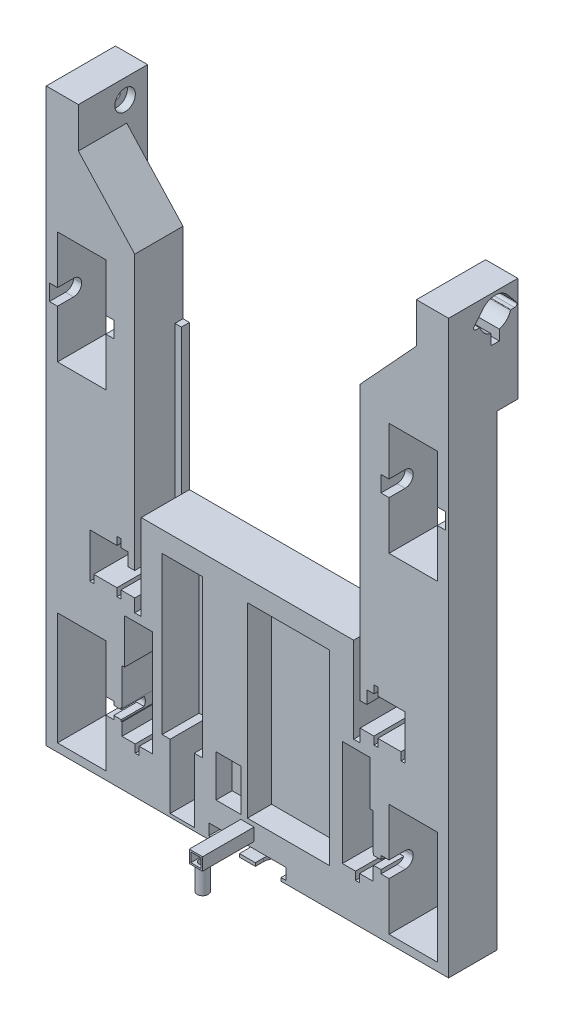
from build123d import *

# Parameters (mm, degrees)
SKETCH1_W                    = 250
SKETCH1_H                    = 330
BOSS_EXTRUDE2_DEPTH          = 30
SKETCH2_W                    = 8.25
SKETCH2_H                    = 7.8
BOSS_EXTRUDE4_DEPTH          = 32
SKETCH6_W                    = 6.25
SKETCH6_H                    = 5.8
CUT_EXTRUDE1_DEPTH           = 7
SKETCH7_R                    = 2.4
CUT_EXTRUDE2_DEPTH           = 1
ULTRASONIC_SENSOR_EYES_DEPTH = 2
SKETCH2_5_W                  = 30
SKETCH2_5_H                  = 70
WHEEL_HOLES_DEPTH            = 416.239689818
SKETCH2_6_W                  = 48
SKETCH2_6_H                  = 7
ULTRASONIC_SENSOR_DEPTH      = 15
SKETCH2_7_W                  = 15
SKETCH2_7_H                  = 40
SKETCH2_7_W_2                = 25
SKETCH2_7_H_2                = 97.5
CUT_EXTRUDE5_DEPTH           = 23
SKETCH2_9_W                  = 51
SKETCH2_9_H                  = 116
CUT_EXTRUDE6_DEPTH           = 15
SKETCH2_10_W                 = 15.5
SKETCH2_10_H                 = 26
CUT_EXTRUDE7_DEPTH           = 10
EXTRUDE_THIN3_START          = 15
SKETCH7_5_R                  = 3.4
SKETCH7_5_R_2                = 2.4
EXTRUDE_THIN3_DEPTH          = 15
SKETCH2_11_W                 = 17.3
SKETCH2_11_H                 = 27.7
SKETCH2_11_W_2               = 2.5
SKETCH2_11_H_2               = 5
CUT_EXTRUDE8_DEPTH           = 21.25
CUT_EXTRUDE9_DEPTH           = 416.239689818
CUT_EXTRUDE9_DEPTH_BACK      = 15
SKETCH2_12_W                 = 5
SKETCH2_12_H                 = 10
CUT_EXTRUDE11_DEPTH          = 25
BOSS_EXTRUDE5_DEPTH          = 20
BOSS_EXTRUDE6_START          = -230
BOSS_EXTRUDE6_DEPTH          = 20
SKETCH8_R                    = 2
CUT_EXTRUDE12_DEPTH          = 15
CUT_EXTRUDE13_DEPTH          = 18
SKETCH8_5_R                  = 2
CUT_EXTRUDE14_DEPTH          = 439.598905607
CUT_EXTRUDE17_DEPTH          = 437.318690867
SKETCH2_17_W                 = 50
SKETCH2_17_H                 = 9
SKETCH2_17_W_2               = 48
SKETCH2_17_H_2               = 7
EXTRUDE_THIN4_DEPTH          = 15
CUT_EXTRUDE18_DEPTH          = 1
FILLET2_R                    = 5
SKETCH2_18_W                 = 4
SKETCH2_18_H                 = 12.24
SKETCH2_18_H_2               = 8
CUT_EXTRUDE19_DEPTH          = 437.318690867
SKETCH15_R                   = 6.39
SKETCH15_R_2                 = 0.9
CUT_EXTRUDE20_DEPTH          = 5
CUT_EXTRUDE21_START          = 215
SKETCH15_2_R                 = 6.39
SKETCH15_2_R_2               = 0.9
CUT_EXTRUDE21_DEPTH          = 5
SKETCH2_19_W                 = 132
SKETCH2_19_H                 = 89.974629058
CUT_EXTRUDE22_DEPTH          = 437.318690867
SKETCH18_W                   = 15
SKETCH18_H                   = 9
CUT_EXTRUDE23_DEPTH          = 412.66734143


with BuildPart() as part:
    # Sketch1 → Boss-Extrude2 (new body)
    with BuildSketch(Plane.XY):
        with Locations((125, 165)):
            Rectangle(SKETCH1_W, SKETCH1_H)
    extrude(amount=BOSS_EXTRUDE2_DEPTH)

    # Sketch2 → Boss-Extrude4 (add)
    with BuildSketch(Plane.XY.offset(30)):
        with Locations((125, 16.9)):
            Rectangle(SKETCH2_W, SKETCH2_H)
    extrude(amount=BOSS_EXTRUDE4_DEPTH)

    # Sketch6 → Cut-Extrude1 (cut)
    with BuildSketch(Plane.XY.offset(62)):
        with Locations((125, 16.9)):
            Rectangle(SKETCH6_W, SKETCH6_H)
    extrude(amount=-CUT_EXTRUDE1_DEPTH, mode=Mode.SUBTRACT)

    # Sketch7 → Cut-Extrude2 (cut)
    with BuildSketch(Plane.XZ.offset(-13)):
        with Locations((125, 57.76)):
            Circle(SKETCH7_R)
    extrude(amount=-CUT_EXTRUDE2_DEPTH, mode=Mode.SUBTRACT)

    # US → Ultrasonic Sensor Eyes (cut)
    with BuildSketch(Plane.XZ):
        with BuildLine():
            Line((104.075, 30), (104.075, 25))
            ThreePointArc((104.075, 25), (112.075, 17), (120.075, 25))
            Line((120.075, 25), (120.075, 30))
            Line((120.075, 30), (104.075, 30))
        make_face()
        with BuildLine():
            Line((145.925, 30), (129.925, 30))
            Line((129.925, 30), (129.925, 25))
            ThreePointArc((129.925, 25), (137.925, 17), (145.925, 25))
            Line((145.925, 25), (145.925, 30))
        make_face()
    extrude(amount=-ULTRASONIC_SENSOR_EYES_DEPTH, mode=Mode.SUBTRACT)

    # Sketch2<5> → Wheel Holes (cut, through all)
    with BuildSketch(Plane.XY.offset(30)):
        with Locations((22, 40)):
            Rectangle(SKETCH2_5_W, SKETCH2_5_H)
        with Locations((228, 40)):
            Rectangle(SKETCH2_5_W, SKETCH2_5_H)
        with Locations((22, 245)):
            Rectangle(SKETCH2_5_W, SKETCH2_5_H)
        with Locations((228, 245)):
            Rectangle(SKETCH2_5_W, SKETCH2_5_H)
    extrude(amount=-WHEEL_HOLES_DEPTH, mode=Mode.SUBTRACT)

    # Sketch2<6> → Ultrasonic Sensor (cut)
    with BuildSketch(Plane.XY.offset(30)):
        with Locations((125, 5.5)):
            Rectangle(SKETCH2_6_W, SKETCH2_6_H)
    extrude(amount=-ULTRASONIC_SENSOR_DEPTH, mode=Mode.SUBTRACT)

    # Sketch2<7> → Cut-Extrude5 (cut)
    with BuildSketch(Plane.XY.offset(30)):
        with Locations((84.5, 22)):
            Rectangle(SKETCH2_7_W, SKETCH2_7_H)
        with Locations((84.5, 90.75)):
            Rectangle(SKETCH2_7_W_2, SKETCH2_7_H_2)
    extrude(amount=-CUT_EXTRUDE5_DEPTH, mode=Mode.SUBTRACT)

    # Sketch2<9> → Cut-Extrude6 (cut)
    with BuildSketch(Plane.XY.offset(30)):
        with Locations((150.5, 81.5)):
            Rectangle(SKETCH2_9_W, SKETCH2_9_H)
    extrude(amount=-CUT_EXTRUDE6_DEPTH, mode=Mode.SUBTRACT)

    # Sketch2<10> → Cut-Extrude7 (cut)
    with BuildSketch(Plane.XY.offset(30)):
        with Locations((113.25, 36.5)):
            Rectangle(SKETCH2_10_W, SKETCH2_10_H)
    extrude(amount=-CUT_EXTRUDE7_DEPTH, mode=Mode.SUBTRACT)

    # Sketch7<5> → Extrude-Thin3 (add)
    with BuildSketch(Plane.XZ.offset(-13).offset(EXTRUDE_THIN3_START)):
        with Locations((125, 57.76)):
            Circle(SKETCH7_5_R)
        with Locations((125, 57.76)):
            Circle(SKETCH7_5_R_2, mode=Mode.SUBTRACT)
    extrude(amount=-EXTRUDE_THIN3_DEPTH)

    # Sketch2<11> → Cut-Extrude8 (cut)
    with BuildSketch(Plane.XY.offset(30)):
        with Locations((57.35, 80.45)):
            Rectangle(SKETCH2_11_W, SKETCH2_11_H)
        Polygon((46.6, 42.675), (46.6, 37.325), (46.6, 36.25), (47.1, 36.25), (47.1, 28.6), (55.3, 28.6), (57.8, 28.6), (66, 28.6), (66, 66.6), (48.7, 66.6), (47.1, 66.6), (47.1, 43.75), (46.6, 43.75), align=None)
        with Locations((192.65, 80.45)):
            Rectangle(SKETCH2_11_W, SKETCH2_11_H)
        Polygon((203.4, 42.675), (203.4, 43.75), (202.9, 43.75), (202.9, 66.6), (201.3, 66.6), (184, 66.6), (184, 28.6), (192.2, 28.6), (194.7, 28.6), (202.9, 28.6), (202.9, 36.25), (203.4, 36.25), (203.4, 37.325), align=None)
        with Locations((193.45, 26.1)):
            Rectangle(SKETCH2_11_W_2, SKETCH2_11_H_2)
        with Locations((56.55, 26.1)):
            Rectangle(SKETCH2_11_W_2, SKETCH2_11_H_2)
    extrude(amount=-CUT_EXTRUDE8_DEPTH, mode=Mode.SUBTRACT)

    # Sketch2<12> → Cut-Extrude9 (cut, two sides: drawn at the far end of the back side and taken through both)
    with BuildSketch(Plane.XY.offset(30).offset(-CUT_EXTRUDE9_DEPTH_BACK)):
        Polygon((37, 45), (42, 45), (42, 42.675), (46.6, 42.675), (46.6, 37.325), (42, 37.325), (42, 35), (37, 35), align=None)
        Polygon((208, 42.675), (203.4, 42.675), (203.4, 37.325), (208, 37.325), (208, 35), (213, 35), (213, 45), (208, 45), align=None)
        with Locations((210.5, 245)):
            Rectangle(SKETCH2_12_W, SKETCH2_12_H)
        with Locations((245.5, 245)):
            Rectangle(SKETCH2_12_W, SKETCH2_12_H)
        with Locations((4.5, 245)):
            Rectangle(SKETCH2_12_W, SKETCH2_12_H)
        with Locations((39.5, 245)):
            Rectangle(SKETCH2_12_W, SKETCH2_12_H)
    extrude(amount=CUT_EXTRUDE9_DEPTH + CUT_EXTRUDE9_DEPTH_BACK, mode=Mode.SUBTRACT)

    # Sketch2<14> → Cut-Extrude11 (cut)
    with BuildSketch(Plane.XY.offset(30)):
        Polygon((50.8, 129.71), (46.39, 129.71), (46.39, 134.62), (43.93, 134.62), (43.93, 129.71), (27.05, 129.71), (27.05, 107), (27.05, 102), (29.54, 102), (29.54, 107), (43.94, 107), (43.94, 102.13), (46.4, 102.13), (46.4, 107), (55, 107), (55, 119.24), (55, 121.74), (50.8, 121.74), align=None)
        Polygon((55, 242.25), (55, 121.74), (55, 119.24), (59, 119.24), (59, 152.275370942), (59, 242.25), align=None)
        Polygon((195, 242.25), (191, 242.25), (191, 152.275370942), (191, 119.24), (195, 119.24), (195, 121.74), align=None)
        Polygon((203.61, 129.71), (203.61, 134.62), (206.07, 134.62), (206.07, 129.71), (222.95, 129.71), (222.95, 107), (222.95, 102), (220.46, 102), (220.46, 107), (206.06, 107), (206.06, 102.13), (203.6, 102.13), (203.6, 107), (195, 107), (195, 121.74), (199.2, 121.74), (199.2, 129.71), align=None)
    extrude(amount=-CUT_EXTRUDE11_DEPTH, mode=Mode.SUBTRACT)

    # Sketch8<6> → Boss-Extrude5 (add)
    with BuildSketch(Plane(origin=(250, 0, 0), x_dir=(0, 0, -1), z_dir=(1, 0, 0))):
        Polygon((0, 290), (13, 290), (13, 355), (-30, 355), (-30, 330), (0, 330), align=None)
    extrude(amount=-BOSS_EXTRUDE5_DEPTH)

    # Sketch8<7> → Boss-Extrude6 (add)
    with BuildSketch(Plane(origin=(250, 0, 0), x_dir=(0, 0, -1), z_dir=(1, 0, 0)).offset(BOSS_EXTRUDE6_START)):
        Polygon((0, 290), (13, 290), (13, 355), (-30, 355), (-30, 330), (0, 330), align=None)
    extrude(amount=-BOSS_EXTRUDE6_DEPTH)

    # Sketch8 → Cut-Extrude12 (cut)
    with BuildSketch(Plane(origin=(250, 0, 0), x_dir=(0, 0, -1), z_dir=(1, 0, 0))):
        with BuildLine():
            ThreePointArc((6.535781289, 349.419821665), (-1.000523494, 352.9), (-8.536828278, 349.419821665))
            Line((-8.536828278, 349.419821665), (-14.167402552, 342.556010673))
            ThreePointArc((-14.167402552, 342.556010673), (-14.351046989, 341.065129745), (-13.081909007, 340.261550251))
            Line((-13.081909007, 340.261550251), (-10.78148506, 340.261550251))
            ThreePointArc((-10.78148506, 340.261550251), (-10.568809618, 340.192013943), (-10.438293426, 340.010267786))
            ThreePointArc((-10.438293426, 340.010267786), (-7.818343872, 335.821746361), (-3.500523494, 333.420855988))
            Line((-3.500523494, 333.420855988), (-3.500523494, 327.035828802))
            Line((-3.500523494, 327.035828802), (1.499476506, 327.035828802))
            Line((1.499476506, 327.035828802), (1.499476506, 333.420855988))
            ThreePointArc((1.499476506, 333.420855988), (5.817296883, 335.821746361), (8.437246438, 340.010267786))
            ThreePointArc((8.437246438, 340.010267786), (8.567762629, 340.192013943), (8.780438072, 340.261550251))
            Line((8.780438072, 340.261550251), (11.080862018, 340.261550251))
            ThreePointArc((11.080862018, 340.261550251), (12.35, 341.065129745), (12.166355564, 342.556010673))
            Line((12.166355564, 342.556010673), (6.535781289, 349.419821665))
        make_face()
        with BuildLine():
            ThreePointArc((-13.081909007, 340.835550251), (-13.911909007, 341.665550251), (-13.081909007, 342.495550251))
            Line((-13.081909007, 342.495550251), (-12.761909007, 342.495550251))
            ThreePointArc((-12.761909007, 342.495550251), (-11.931909007, 341.665550251), (-12.761909007, 340.835550251))
            Line((-12.761909007, 340.835550251), (-13.081909007, 340.835550251))
        make_face(mode=Mode.SUBTRACT)
        with Locations(Location((-1.000523494, 343, 0), (0, 0, 90))):
            Circle(SKETCH8_R, mode=Mode.SUBTRACT)
        with BuildLine():
            Line((10.760862018, 342.495550251), (11.080862018, 342.495550251))
            ThreePointArc((11.080862018, 342.495550251), (11.910862018, 341.665550251), (11.080862018, 340.835550251))
            Line((11.080862018, 340.835550251), (10.760862018, 340.835550251))
            ThreePointArc((10.760862018, 340.835550251), (9.930862018, 341.665550251), (10.760862018, 342.495550251))
        make_face(mode=Mode.SUBTRACT)
    extrude(amount=-CUT_EXTRUDE12_DEPTH, mode=Mode.SUBTRACT)

    # Sketch8<4> → Cut-Extrude13 (cut)
    with BuildSketch(Plane(origin=(250, 0, 0), x_dir=(0, 0, -1), z_dir=(1, 0, 0))):
        with BuildLine():
            Line((-13.081909007, 340.835550251), (-12.761909007, 340.835550251))
            ThreePointArc((-12.761909007, 340.835550251), (-11.931909007, 341.665550251), (-12.761909007, 342.495550251))
            Line((-12.761909007, 342.495550251), (-13.081909007, 342.495550251))
            ThreePointArc((-13.081909007, 342.495550251), (-13.911909007, 341.665550251), (-13.081909007, 340.835550251))
        make_face()
        with BuildLine():
            ThreePointArc((10.760862018, 340.835550251), (9.930862018, 341.665550251), (10.760862018, 342.495550251))
            Line((10.760862018, 342.495550251), (11.080862018, 342.495550251))
            ThreePointArc((11.080862018, 342.495550251), (11.910862018, 341.665550251), (11.080862018, 340.835550251))
            Line((11.080862018, 340.835550251), (10.760862018, 340.835550251))
        make_face()
    extrude(amount=-CUT_EXTRUDE13_DEPTH, mode=Mode.SUBTRACT)

    # Sketch8<5> → Cut-Extrude14 (cut, through all)
    with BuildSketch(Plane(origin=(250, 0, 0), x_dir=(0, 0, -1), z_dir=(1, 0, 0))):
        with Locations(Location((-1.000523494, 343, 0), (0, 0, 90))):
            Circle(SKETCH8_5_R)
    extrude(amount=-CUT_EXTRUDE14_DEPTH, mode=Mode.SUBTRACT)

    # Sketch2<16> → Cut-Extrude17 (cut, through all)
    with BuildSketch(Plane.XY.offset(30)):
        Polygon((20, 330), (55, 292), (55, 242.25), (195, 242.25), (195, 292), (230, 330), align=None)
    extrude(amount=-CUT_EXTRUDE17_DEPTH, mode=Mode.SUBTRACT)

    # Sketch2<17> → Extrude-Thin4 (add)
    with BuildSketch(Plane.XY.offset(30)):
        with Locations((26, 288.5)):
            Rectangle(SKETCH2_17_W, SKETCH2_17_H)
        with Locations((26, 288.5)):
            Rectangle(SKETCH2_17_W_2, SKETCH2_17_H_2, mode=Mode.SUBTRACT)
    extrude(amount=EXTRUDE_THIN4_DEPTH)

    # Sketch13 → Cut-Extrude18 (cut)
    with BuildSketch(Plane(origin=(0, 293, 0), x_dir=(1, 0, 0), z_dir=(0, 1, 0))):
        with BuildLine():
            Line((4.075, -45), (20.075, -45))
            Line((20.075, -45), (20.075, -40))
            ThreePointArc((20.075, -40), (12.075, -32), (4.075, -40))
            Line((4.075, -40), (4.075, -45))
        make_face()
        with BuildLine():
            Line((45.925, -45), (45.925, -40))
            ThreePointArc((45.925, -40), (37.925, -32), (29.925, -40))
            Line((29.925, -40), (29.925, -45))
            Line((29.925, -45), (45.925, -45))
        make_face()
    extrude(amount=-CUT_EXTRUDE18_DEPTH, mode=Mode.SUBTRACT)

    # Fillet2
    fillet2_edges = [part.edges().sort_by_distance(p)[0] for p in [
        (39.5, 45, 15),
        (39.5, 35, 15),
        (210.5, 35, 15),
        (210.5, 45, 15),
        (210.5, 250, 15),
        (245.5, 250, 15),
        (245.5, 240, 15),
        (210.5, 240, 15),
        (4.5, 240, 15),
        (4.5, 250, 15),
        (39.5, 240, 15),
        (39.5, 250, 15),
    ]]
    fillet(fillet2_edges, radius=FILLET2_R - 0.0001)  # a hair under: the kernel refuses the full size

    # Sketch2<18> → Cut-Extrude19 (cut, through all)
    with BuildSketch(Plane.XY.offset(30)):
        with Locations((57, 113.12)):
            Rectangle(SKETCH2_18_W, SKETCH2_18_H)
        with Locations((57, 103)):
            Rectangle(SKETCH2_18_W, SKETCH2_18_H_2)
        with Locations((193, 113.12)):
            Rectangle(SKETCH2_18_W, SKETCH2_18_H)
        with Locations((193, 103)):
            Rectangle(SKETCH2_18_W, SKETCH2_18_H_2)
    extrude(amount=-CUT_EXTRUDE19_DEPTH, mode=Mode.SUBTRACT)

    # Sketch15 → Cut-Extrude20 (cut)
    with BuildSketch(Plane.ZY.offset(-230)):
        with Locations(Location((1.000523494, 343, 0), (0, 0, 270))):
            Circle(SKETCH15_R)
        with Locations((1.000523494, 343)):
            Circle(SKETCH15_R_2, mode=Mode.SUBTRACT)
    extrude(amount=-CUT_EXTRUDE20_DEPTH, mode=Mode.SUBTRACT)

    # Sketch15<2> → Cut-Extrude21 (cut)
    with BuildSketch(Plane.ZY.offset(-230).offset(CUT_EXTRUDE21_START)):
        with Locations(Location((1.000523494, 343, 0), (0, 0, 270))):
            Circle(SKETCH15_2_R)
        with Locations((1.000523494, 343)):
            Circle(SKETCH15_2_R_2, mode=Mode.SUBTRACT)
    extrude(amount=-CUT_EXTRUDE21_DEPTH, mode=Mode.SUBTRACT)

    # Sketch2<19> → Cut-Extrude22 (cut, through all)
    with BuildSketch(Plane.XY.offset(30)):
        with Locations((125, 197.262685471)):
            Rectangle(SKETCH2_19_W, SKETCH2_19_H)
    extrude(amount=-CUT_EXTRUDE22_DEPTH, mode=Mode.SUBTRACT)

    # Sketch18 → Cut-Extrude23 (cut, through all)
    with BuildSketch(Plane(origin=(51, 0, 0), x_dir=(0, 0, -1), z_dir=(1, 0, 0))):
        with Locations((-37.5, 288.5)):
            Rectangle(SKETCH18_W, SKETCH18_H)
    extrude(amount=-CUT_EXTRUDE23_DEPTH, mode=Mode.SUBTRACT)


solid = part.part
